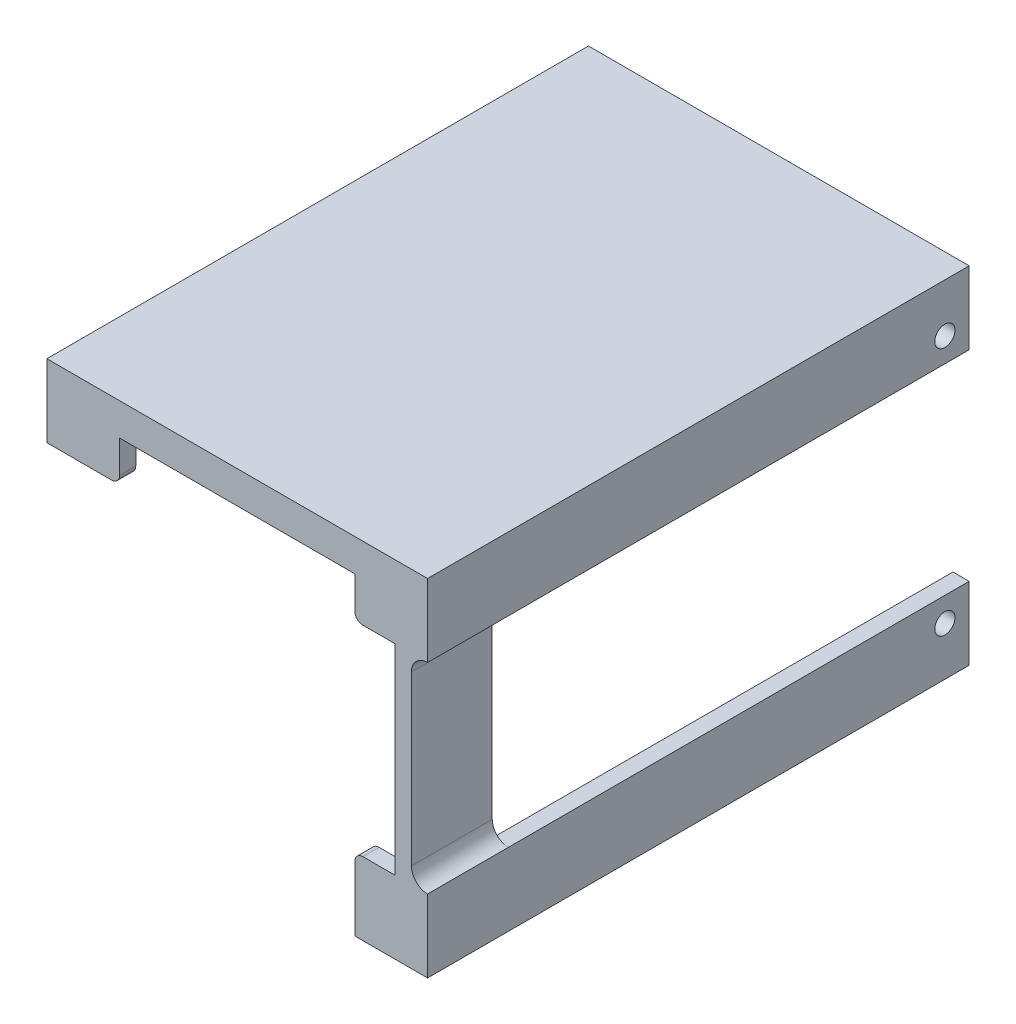
from build123d import *

# Parameters (mm, degrees)
EXTRUDE_THIN1_DEPTH  = 10
SKETCH2_W            = 7
SKETCH2_H            = 7
BOSS_EXTRUDE1_DEPTH  = 2
FILLET1_R            = 1
BOSS_EXTRUDE2_DEPTH  = 67
SKETCH4_R            = 1.25
CUT_EXTRUDE1_DEPTH   = 91.624775862
FILLET2_R            = 2
MOVE_START           = -67
MOVE_FACE1_OUTLINE_W = 29.1
MOVE_FACE1_OUTLINE_H = 2
MOVE_FACE1_DEPTH     = 67


# Read off the part's stored shape, not the designer's step: Move Face1
with BuildPart() as part:
    # Sketch1 → Extrude-Thin1 (new body)
    with BuildSketch(Plane.XY):
        Polygon((0, -5), (0, 0), (39.1, 0), (39.1, -34.8), (34.1, -34.8), (34.1, -36.8), (41.1, -36.8), (41.1, 2), (-2, 2), (-2, -5), align=None)
    extrude(amount=-EXTRUDE_THIN1_DEPTH)

    # Sketch2 → Boss-Extrude1 (add)
    with BuildSketch(Plane.XY):
        with Locations((1.5, -1.5)):
            Rectangle(SKETCH2_W, SKETCH2_H)
        with Locations((37.6, -1.5)):
            Rectangle(SKETCH2_W, SKETCH2_H)
        with Locations((37.6, -33.3)):
            Rectangle(SKETCH2_W, SKETCH2_H)
    extrude(amount=-BOSS_EXTRUDE1_DEPTH)

    # Fillet1
    fillet1_edges = [part.edges().sort_by_distance(p)[0] for p in [
        (5, -5, -1),
        (34.1, -5, -1),
        (34.1, -29.8, -1),
    ]]
    fillet(fillet1_edges, radius=FILLET1_R)

    # Sketch3 → Boss-Extrude2 (add)
    with BuildSketch(Plane.XY):
        Polygon((34.1, 2), (41.1, 2), (41.1, -5), (43.1, -5), (43.1, 4), (34.1, 4), align=None)
    boss_extrude2 = extrude(amount=-BOSS_EXTRUDE2_DEPTH)

    # Mirror1: Boss-Extrude2 across plane
    add(boss_extrude2.mirror(Plane(origin=(19.55, 0, 0), x_dir=(0, 0, 1), z_dir=(1, 0, 0))))

    # Mirror2: Boss-Extrude2 across plane
    add(boss_extrude2.mirror(Plane.ZX.offset(-17.4)))

    # Sketch4 → Cut-Extrude1 (cut, through all)
    with BuildSketch(Plane(origin=(43.1, 0, 0), x_dir=(0, 0, -1), z_dir=(1, 0, 0))):
        with Locations((64, -2)):
            Circle(SKETCH4_R)
    cut_extrude1 = extrude(amount=-CUT_EXTRUDE1_DEPTH, mode=Mode.SUBTRACT)

    # Mirror3: Cut-Extrude1 across plane
    add(cut_extrude1.mirror(Plane.ZX.offset(-17.4)), mode=Mode.SUBTRACT)

    # Fillet2
    fillet2_edges = [part.edges().sort_by_distance(p)[0] for p in [
        (41.1, -29.8, -5),
        (41.1, -5, -5),
    ]]
    fillet(fillet2_edges, radius=FILLET2_R - 0.0001)  # a hair under: the kernel refuses the full size

    # Move Face1 outline → Move Face1 (add)
    with BuildSketch(Plane.XY.offset(MOVE_START)):
        with Locations((19.55, 3)):
            Rectangle(MOVE_FACE1_OUTLINE_W, MOVE_FACE1_OUTLINE_H)
    extrude(amount=MOVE_FACE1_DEPTH)


solid = part.part
